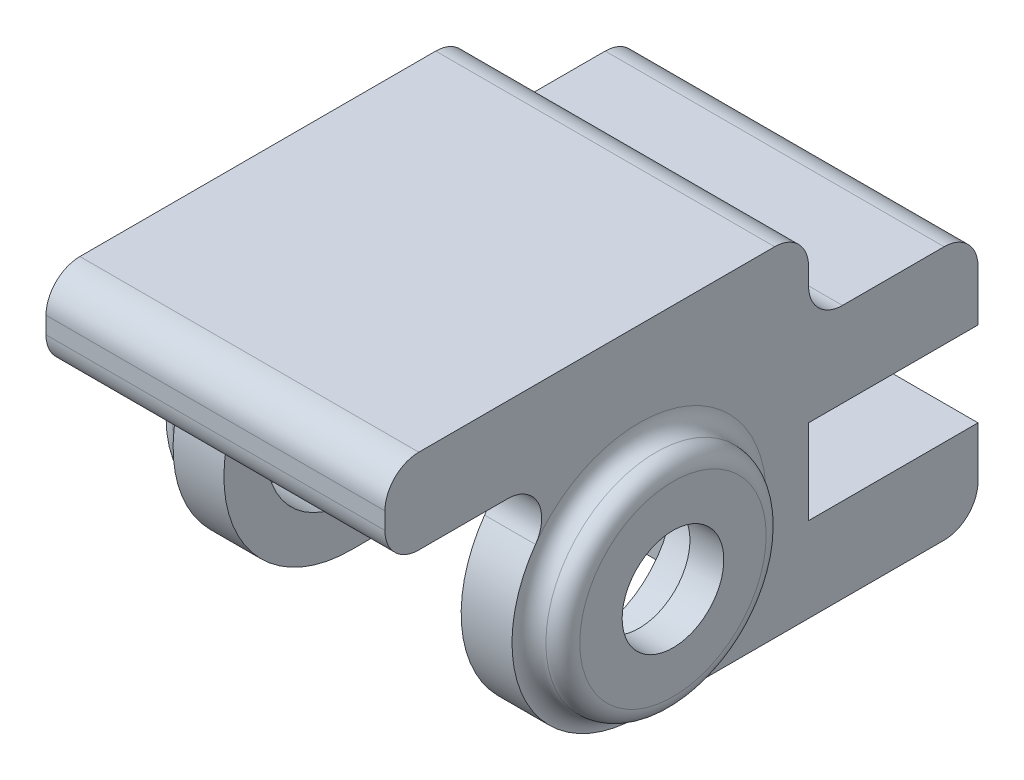
from build123d import *

# Parameters (mm, degrees)
SKETCH_1_R               = 5
EXTRUDE_1_DEPTH          = 10
CUT_EXTRUDE_1_DEPTH      = 24.58495283
CUT_EXTRUDE_1_DEPTH_BACK = 24.58495283
SKETCH_2_W               = 14
SKETCH_2_H               = 16
SKETCH_3_W               = 20
SKETCH_3_H               = 35
EXTRUDE_2_DEPTH          = 5
FILLET_3_R               = 2
SKETCH_4_W               = 20
SKETCH_4_H               = 10
CUT_EXTRUDE_2_DEPTH      = 5
FILLET_4_R               = 2
FILLET_5_R               = 5
SKETCH_5_R               = 6.5
SKETCH_5_R_2             = 3
EXTRUDE_3_DEPTH          = 2
FILLET_6_R               = 1


with BuildPart() as part:
    # 草图1 → 凸台-拉伸1 (new, symmetric)
    with BuildSketch(Plane(origin=(0, 0, 0), x_dir=(0, 0, -1), z_dir=(1, 0, 0))):
        with BuildLine():
            Line((20, 7.5), (0, 7.5))
            ThreePointArc((0, 7.5), (-7.5, 0), (0, -7.5))
            Line((0, -7.5), (20, -7.5))
            Line((20, -7.5), (20, -2.5))
            Line((20, -2.5), (10, -2.5))
            Line((10, -2.5), (10, 2.5))
            Line((10, 2.5), (20, 2.5))
            Line((20, 2.5), (20, 7.5))
        make_face()
        Circle(SKETCH_1_R, mode=Mode.SUBTRACT)
    extrude(amount=EXTRUDE_1_DEPTH, both=True)

    # 草图2 → 切除-拉伸1 (cut, two sides: drawn at the far end of the back side and taken through both)
    with BuildSketch(Plane(origin=(0, 0, 0), x_dir=(1, 0, 0), z_dir=(0, 1, 0)).offset(-CUT_EXTRUDE_1_DEPTH_BACK)):
        with Locations((0, 0.5)):
            Rectangle(SKETCH_2_W, SKETCH_2_H)
    extrude(amount=CUT_EXTRUDE_1_DEPTH + CUT_EXTRUDE_1_DEPTH_BACK, mode=Mode.SUBTRACT)

    # 草图3 → 凸台-拉伸2 (add)
    with BuildSketch(Plane(origin=(0, 7.5, 0), x_dir=(1, 0, 0), z_dir=(0, 1, 0))):
        with Locations((0, 2.5)):
            Rectangle(SKETCH_3_W, SKETCH_3_H)
    extrude(amount=EXTRUDE_2_DEPTH)

    # 圆角3
    fillet_3_edges = [part.edges().sort_by_distance(p)[0] for p in [
        (0, -7.5, -20),
        (8.5, 7.5, 0),
        (-8.5, 7.5, 0),
        (0, 7.5, 15),
        (0, 12.5, 15),
    ]]
    fillet(fillet_3_edges, radius=FILLET_3_R)

    # 草图4 → 切除-拉伸2 (cut)
    with BuildSketch(Plane(origin=(0, 12.5, 0), x_dir=(1, 0, 0), z_dir=(0, 1, 0))):
        with Locations((0, 15)):
            Rectangle(SKETCH_4_W, SKETCH_4_H)
    extrude(amount=-CUT_EXTRUDE_2_DEPTH, mode=Mode.SUBTRACT)

    # 圆角4
    fillet_4_edges = [part.edges().sort_by_distance(p)[0] for p in [
        (0, 7.5, -10),
        (0, 7.5, -20),
        (0, 12.5, -10),
    ]]
    fillet(fillet_4_edges, radius=FILLET_4_R)

    # 圆角5
    fillet_5_edges = [part.edges().sort_by_distance(p)[0] for p in [
        (0, 7.5, -8.5),
    ]]
    fillet(fillet_5_edges, radius=FILLET_5_R)

    # 草图5 → 凸台-拉伸3 (add)
    with BuildSketch(Plane.ZY.offset(10)):
        with Locations(Location((0, 0, 0), (0, 0, 180))):
            Circle(SKETCH_5_R)
        Circle(SKETCH_5_R_2, mode=Mode.SUBTRACT)
    extrude_3 = extrude(amount=EXTRUDE_3_DEPTH)

    # 圆角6
    fillet_6_edges = [part.edges().sort_by_distance(p)[0] for p in [
        (-10, 0, 6.5),
        (-12, 0, 6.5),
    ]]
    fillet(fillet_6_edges, radius=FILLET_6_R - 0.0001)  # a hair under: the kernel refuses the full size

    # 镜向1: 凸台-拉伸3 across plane
    add(extrude_3.mirror(Plane(origin=(0, 0, 0), x_dir=(0, 0, 1), z_dir=(1, 0, 0))))

    # 圆角7: read off the stored shape, not the designer's step
    # 圆角7 outline → 圆角7 (revolve, cut)
    with BuildSketch(Plane.YX):
        with BuildLine():
            ThreePointArc((5.5, 12), (6.207106781, 11.707106781), (6.5, 11))
            ThreePointArc((6.5, 11), (6.792893219, 10.292893219), (7.5, 10))
            Line((7.5, 10), (7.5, 12))
            Line((7.5, 12), (5.5, 12))
        make_face()
    revolve(axis=Axis((0, 0, 0), (1, 0, 0)), mode=Mode.SUBTRACT)

    # Fillet 7 2 outline → Fillet 7 2 (revolve)
    with BuildSketch(Plane.YX):
        with BuildLine():
            ThreePointArc((7.5, 10), (6.792893219, 10.292893219), (6.5, 11))
            ThreePointArc((6.5, 11), (6.207106781, 11.707106781), (5.5, 12))
            Line((5.5, 12), (5.5, 10))
            Line((5.5, 10), (7.5, 10))
        make_face()
    revolve(axis=Axis((0, 0, 0), (1, 0, 0)))


solid = part.part
